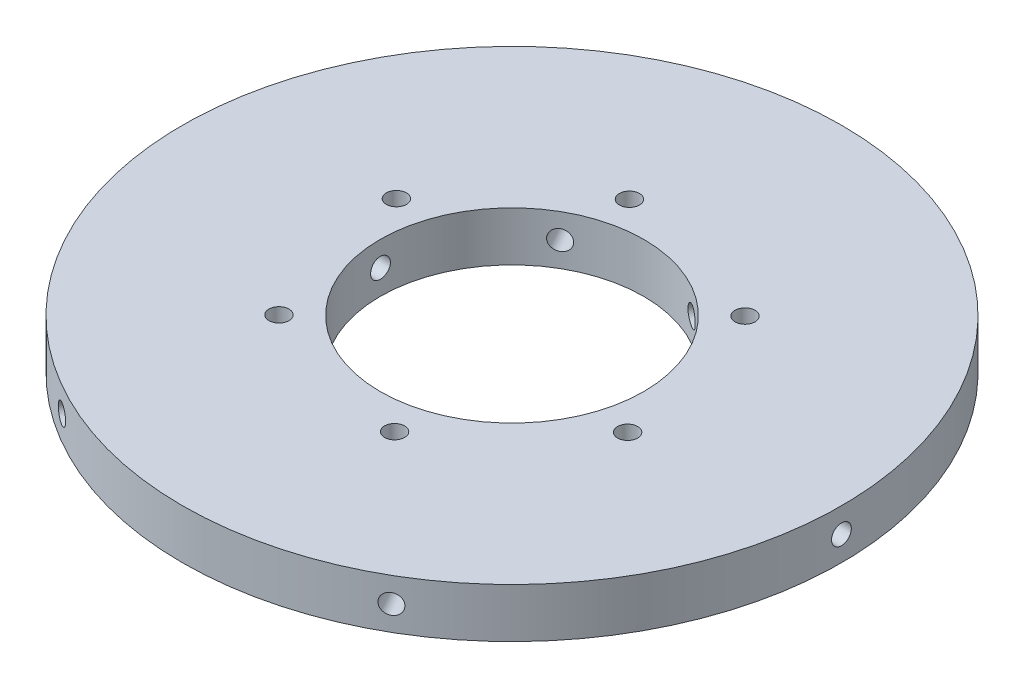
from build123d import *

# Parameters (mm, degrees)
SKETCH1_R             = 100
SKETCH1_R_2           = 40
SKETCH1_R_3           = 3.05
BOSS_EXTRUDE1_DEPTH   = 15
SKETCH2_R             = 3
CUT_EXTRUDE1_DEPTH    = 143.214626533
CIRPATTERN1_COUNT     = 6
CIRPATTERN2_OUTLINE_R = 3.05
CIRPATTERN2_DEPTH     = 15


# Read off the part's stored shape, not the designer's step: CirPattern2
with BuildPart() as part:
    # Sketch1 → Boss-Extrude1 (new body)
    with BuildSketch(Plane(origin=(0, 0, 0), x_dir=(1, 0, 0), z_dir=(0, 1, 0))):
        with Locations(Location((0, 0, 0), (0, 0, 270))):
            Circle(SKETCH1_R)
        with Locations(Location((0, 0, 0), (0, 0, 270))):
            Circle(SKETCH1_R_2, mode=Mode.SUBTRACT)
        with Locations(Location((12.723046489, -48.354152749, 0), (0, 0, 270))):
            Circle(SKETCH1_R_3, mode=Mode.SUBTRACT)
    extrude(amount=BOSS_EXTRUDE1_DEPTH)

    # Sketch2 → Cut-Extrude1 (cut, through all)
    with BuildSketch(Plane(origin=(0, 0, 0), x_dir=(0, 0, -1), z_dir=(1, 0, 0))):
        with Locations((0, 7.5)):
            Circle(SKETCH2_R)
    cut_extrude1 = extrude(amount=-CUT_EXTRUDE1_DEPTH, mode=Mode.SUBTRACT)

    # CirPattern1: Cut-Extrude1 ×6 about axis
    cirpattern1_axis = Axis((0, 15, 0), (0, 1, 0))
    for i in range(1, CIRPATTERN1_COUNT):
        add(cut_extrude1.rotate(cirpattern1_axis, i * 360 / CIRPATTERN1_COUNT), mode=Mode.SUBTRACT)

    # CirPattern2 outline → CirPattern2 (cut)
    with BuildSketch(Plane(origin=(0, 0, 0), x_dir=(1, 0, 0), z_dir=(0, 1, 0))):
        with Locations((-35.514401414, -35.195557847)):
            Circle(CIRPATTERN2_OUTLINE_R)
        with Locations((-48.237447903, 13.158594901)):
            Circle(CIRPATTERN2_OUTLINE_R)
        with Locations((-12.723046489, 48.354152749)):
            Circle(CIRPATTERN2_OUTLINE_R)
        with Locations((35.514401414, 35.195557847)):
            Circle(CIRPATTERN2_OUTLINE_R)
        with Locations((48.237447903, -13.158594901)):
            Circle(CIRPATTERN2_OUTLINE_R)
    extrude(amount=CIRPATTERN2_DEPTH, mode=Mode.SUBTRACT)


solid = part.part
